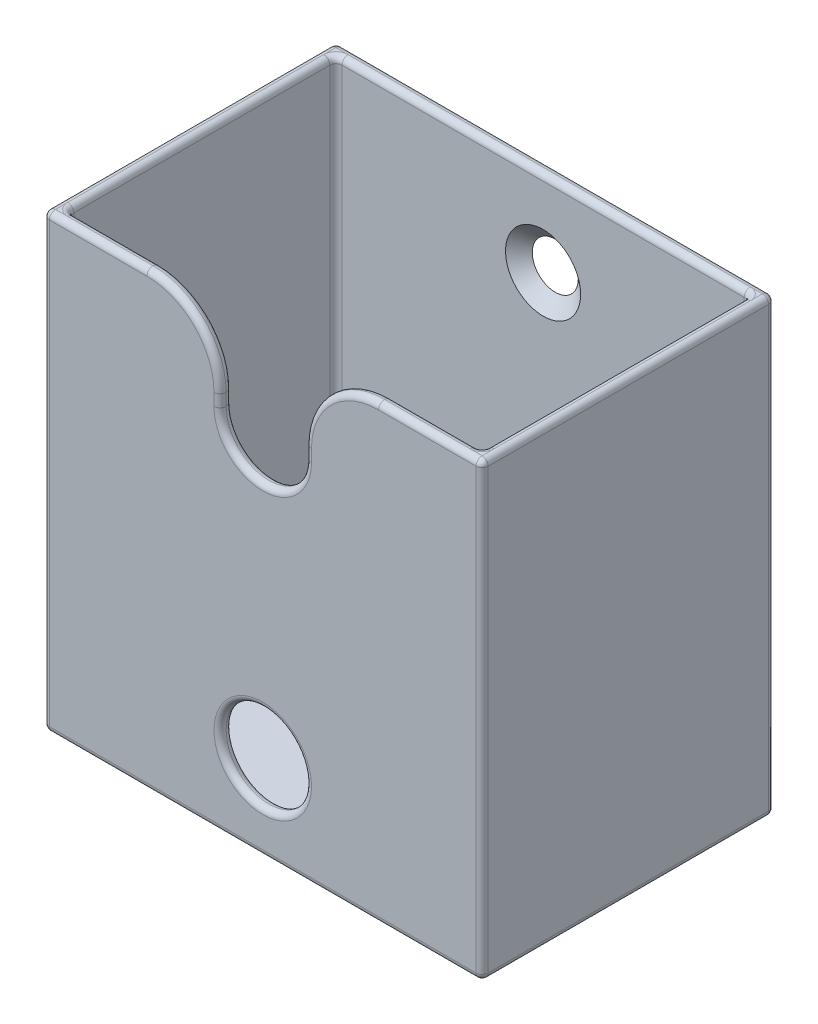
from build123d import *

# Parameters (mm, degrees)
SKETCH1_W                                  = 57.15
SKETCH1_H                                  = 38.1
SKETCH1_W_2                                = 53.975
SKETCH1_H_2                                = 34.925
EXTRUDE_THIN1_DEPTH                        = 28.575
SKETCH2_W                                  = 57.15
SKETCH2_H                                  = 38.1
BOSS_EXTRUDE1_DEPTH                        = 1.5875
CUT_EXTRUDE1_REACH                         = 58.373
SKETCH3_R                                  = 5.55625
CSK_FOR_10_FLAT_HEAD_MACHINE_SCREW_2_COUNT = 2
CSK_FOR_10_FLAT_HEAD_MACHINE_SCREW_2_PITCH = 36.5125
FILLET1_R                                  = 9.525
FILLET4_R                                  = 0.79375


with BuildPart() as part:
    # Sketch1 → Extrude-Thin1 (new, symmetric)
    with BuildSketch(Plane(origin=(0, 0, 0), x_dir=(1, 0, 0), z_dir=(0, 1, 0))):
        Rectangle(SKETCH1_W, SKETCH1_H)
        Rectangle(SKETCH1_W_2, SKETCH1_H_2, mode=Mode.SUBTRACT)
    extrude(amount=EXTRUDE_THIN1_DEPTH, both=True)

    # Sketch2 → Boss-Extrude1 (add)
    with BuildSketch(Plane.XZ.offset(28.575)):
        Rectangle(SKETCH2_W, SKETCH2_H)
    extrude(amount=BOSS_EXTRUDE1_DEPTH)

    # Sketch3 → Cut-Extrude1 (cut, up to next)
    with BuildSketch(Plane.XY.offset(19.05), mode=Mode.PRIVATE) as cut_extrude1_sk1:
        with Locations((0, -19.05)):
            Circle(SKETCH3_R)
    cut_extrude1_tool1 = extrude(cut_extrude1_sk1.sketch, amount=-CUT_EXTRUDE1_REACH, mode=Mode.PRIVATE) & part.part
    # Sketch3 → Cut-Extrude1 (cut, up to next)
    with BuildSketch(Plane.XY.offset(19.05), mode=Mode.PRIVATE) as cut_extrude1_sk2:
        with BuildLine():
            Line((5.55625, 28.575), (5.55625, 17.4625))
            ThreePointArc((5.55625, 17.4625), (0, 11.90625), (-5.55625, 17.4625))
            Line((-5.55625, 17.4625), (-5.55625, 28.575))
            ThreePointArc((-5.55625, 28.575), (0, 34.13125), (5.55625, 28.575))
        make_face()
    cut_extrude1_tool2 = extrude(cut_extrude1_sk2.sketch, amount=-CUT_EXTRUDE1_REACH, mode=Mode.PRIVATE) & part.part
    add(cut_extrude1_tool1.solids().sort_by_distance((0, -19.05, 19.05))[0], mode=Mode.SUBTRACT)
    add(cut_extrude1_tool2.solids().sort_by_distance((0, 23.01875, 19.05))[0], mode=Mode.SUBTRACT)

    # Sketch5 → CSK for #10 Flat Head Machine Screw (100)1 (revolve, cut)
    with BuildSketch(Plane(origin=(0, 17.4625, -17.4625), x_dir=(0, -1, 0), z_dir=(1, 0, 0))):
        Polygon((0, 0), (0, 1.5875), (2.5527, 1.5875), (2.5527, 1.960808018), (4.8895, 0), align=None)
    csk_for_10_flat_head_machine_screw_100 = revolve(axis=Axis((0, 17.4625, -11.1125), (0, 0, -1)), mode=Mode.SUBTRACT)

    # CSK for _10 Flat Head Machine Screw  2: CSK for #10 Flat Head Machine Screw (100)1 ×2
    with Locations(*[(0, -i * CSK_FOR_10_FLAT_HEAD_MACHINE_SCREW_2_PITCH, 0) for i in range(1, CSK_FOR_10_FLAT_HEAD_MACHINE_SCREW_2_COUNT)]):
        add(csk_for_10_flat_head_machine_screw_100, mode=Mode.SUBTRACT)

    # Fillet1
    fillet1_edges = [part.edges().sort_by_distance(p)[0] for p in [
        (-5.55625, 28.575, 18.25625),
        (5.55625, 28.575, 18.25625),
    ]]
    fillet(fillet1_edges, radius=FILLET1_R)

    # Fillet4
    fillet4_edges = [part.edges().sort_by_distance(p)[0] for p in [
        (-8.346057909, 25.785192091, 19.05),
        (-5.55625, 18.25625, 19.05),
        (0, 11.90625, 19.05),
        (5.55625, 18.25625, 19.05),
        (8.346057909, 25.785192091, 19.05),
        (0, -30.1625, 19.05),
        (0, -30.1625, -19.05),
        (-28.575, -0.79375, 19.05),
        (-28.575, -30.1625, 0),
        (-28.575, -0.79375, -19.05),
        (28.575, -0.79375, -19.05),
        (28.575, -30.1625, 0),
        (28.575, -0.79375, 19.05),
        (0, 11.90625, 17.4625),
        (-5.55625, 18.25625, 17.4625),
        (-8.346057909, 25.785192091, 17.4625),
        (-26.9875, 0, 17.4625),
        (26.9875, 0, 17.4625),
        (8.346057909, 25.785192091, 17.4625),
        (5.55625, 18.25625, 17.4625),
        (26.9875, 28.575, 0),
        (0, 28.575, -17.4625),
        (-26.9875, 28.575, 0),
        (-21.034375, 28.575, 17.4625),
        (-21.828125, 28.575, 19.05),
        (-28.575, 28.575, 0),
        (0, 28.575, -19.05),
        (28.575, 28.575, 0),
        (21.828125, 28.575, 19.05),
        (21.034375, 28.575, 17.4625),
        (-5.55625, -19.05, 19.05),
        (-5.55625, -19.05, 17.4625),
        (-26.9875, -28.575, 0),
        (0, -28.575, -17.4625),
        (26.9875, -28.575, 0),
        (0, -28.575, 17.4625),
        (26.9875, 0, -17.4625),
        (-26.9875, 0, -17.4625),
    ]]
    fillet(fillet4_edges, radius=FILLET4_R - 0.0001)  # a hair under: the kernel refuses the full size


solid = part.part
